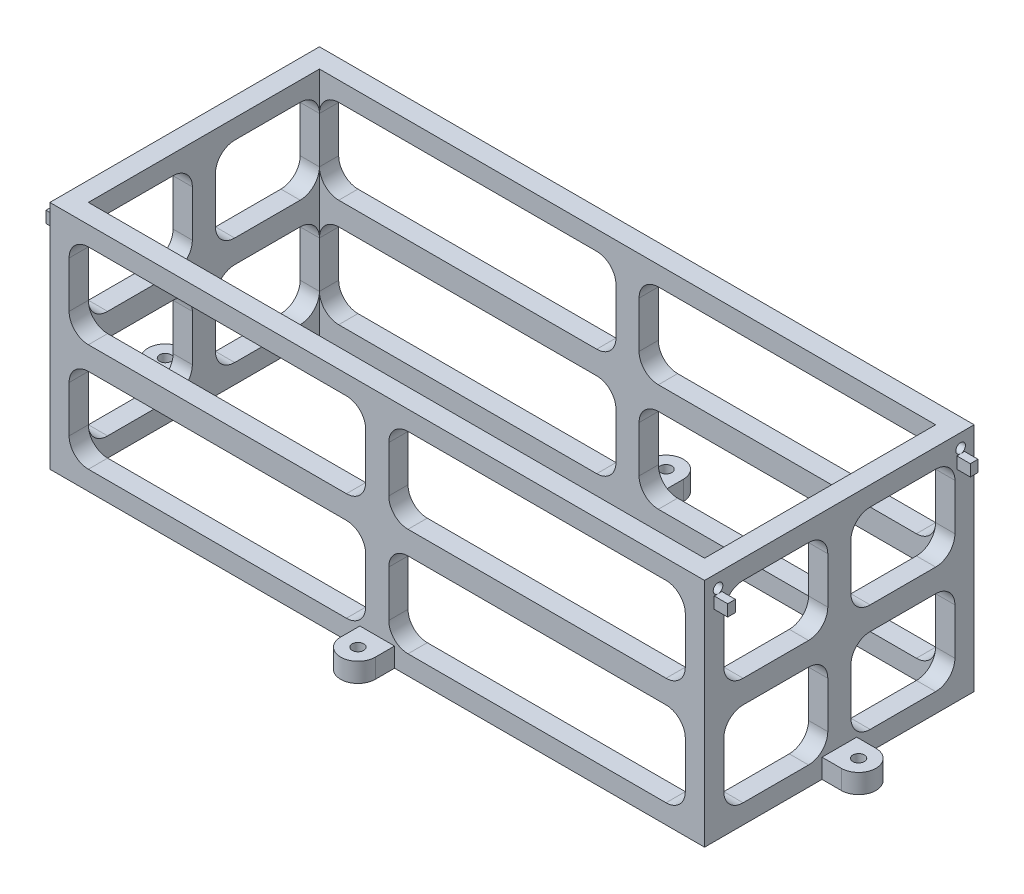
from build123d import *

# Parameters (mm, degrees)
SKETCH1_W           = 170
SKETCH1_H           = 70
BOSS_EXTRUDE1_DEPTH = 60
SHELL1_T            = -5
CUT_EXTRUDE1_DEPTH  = 170
CUT_EXTRUDE2_DEPTH  = 90
SKETCH6_R           = 4.5
SKETCH6_R_2         = 1.5
SKETCH6_W           = 9
SKETCH6_H           = 10
SKETCH6_W_2         = 10
SKETCH6_H_2         = 9
BOSS_EXTRUDE2_DEPTH = 5
SKETCH7_R           = 1.5
CUT_EXTRUDE3_DEPTH  = 5
SKETCH8_R           = 1.25
CUT_EXTRUDE4_DEPTH  = 5
CUT_EXTRUDE5_START  = -5
SKETCH9_R           = 1.25
CUT_EXTRUDE5_DEPTH  = 5
SKETCH10_W          = 2
SKETCH10_H          = 3
BOSS_EXTRUDE3_DEPTH = 3.5
SKETCH11_W          = 2
SKETCH11_H          = 3
BOSS_EXTRUDE4_DEPTH = 3.5


with BuildPart() as part:
    # Sketch1 → Boss-Extrude1 (new body)
    with BuildSketch(Plane(origin=(0, 0, 0), x_dir=(1, 0, 0), z_dir=(0, 1, 0))):
        Rectangle(SKETCH1_W, SKETCH1_H)
    extrude(amount=BOSS_EXTRUDE1_DEPTH)

    # Shell1
    shell1_openings = [part.faces().sort_by_distance(p)[0] for p in [
        (0, 60, 0),
        (0, 0, 0),
    ]]
    offset(amount=SHELL1_T, openings=shell1_openings, kind=Kind.INTERSECTION)

    # Sketch4 → Cut-Extrude1 (cut)
    with BuildSketch(Plane(origin=(85, 0, 0), x_dir=(0, 0, -1), z_dir=(1, 0, 0))):
        with BuildLine():
            Line((-25, 55), (-8, 55))
            ThreePointArc((-8, 55), (-4.464466094, 53.535533906), (-3, 50))
            Line((-3, 50), (-3, 38))
            ThreePointArc((-3, 38), (-4.464466094, 34.464466094), (-8, 33))
            Line((-8, 33), (-25, 33))
            ThreePointArc((-25, 33), (-28.535533906, 34.464466094), (-30, 38))
            Line((-30, 38), (-30, 50))
            ThreePointArc((-30, 50), (-28.535533906, 53.535533906), (-25, 55))
        make_face()
        with BuildLine():
            Line((-25, 27), (-8, 27))
            ThreePointArc((-8, 27), (-4.464466094, 25.535533906), (-3, 22))
            Line((-3, 22), (-3, 10))
            ThreePointArc((-3, 10), (-4.464466094, 6.464466094), (-8, 5))
            Line((-8, 5), (-25, 5))
            ThreePointArc((-25, 5), (-28.535533906, 6.464466094), (-30, 10))
            Line((-30, 10), (-30, 22))
            ThreePointArc((-30, 22), (-28.535533906, 25.535533906), (-25, 27))
        make_face()
        with BuildLine():
            Line((8, 55), (25, 55))
            ThreePointArc((25, 55), (28.535533906, 53.535533906), (30, 50))
            Line((30, 50), (30, 38))
            ThreePointArc((30, 38), (28.535533906, 34.464466094), (25, 33))
            Line((25, 33), (8, 33))
            ThreePointArc((8, 33), (4.464466094, 34.464466094), (3, 38))
            Line((3, 38), (3, 50))
            ThreePointArc((3, 50), (4.464466094, 53.535533906), (8, 55))
        make_face()
        with BuildLine():
            Line((8, 27), (25, 27))
            ThreePointArc((25, 27), (28.535533906, 25.535533906), (30, 22))
            Line((30, 22), (30, 10))
            ThreePointArc((30, 10), (28.535533906, 6.464466094), (25, 5))
            Line((25, 5), (8, 5))
            ThreePointArc((8, 5), (4.464466094, 6.464466094), (3, 10))
            Line((3, 10), (3, 22))
            ThreePointArc((3, 22), (4.464466094, 25.535533906), (8, 27))
        make_face()
    extrude(amount=-CUT_EXTRUDE1_DEPTH, mode=Mode.SUBTRACT)

    # Sketch5 → Cut-Extrude2 (cut)
    with BuildSketch(Plane.XY.offset(35)):
        with BuildLine():
            Line((-75, 55), (-8, 55))
            ThreePointArc((-8, 55), (-4.464466094, 53.535533906), (-3, 50))
            Line((-3, 50), (-3, 38))
            ThreePointArc((-3, 38), (-4.464466094, 34.464466094), (-8, 33))
            Line((-8, 33), (-75, 33))
            ThreePointArc((-75, 33), (-78.535533906, 34.464466094), (-80, 38))
            Line((-80, 38), (-80, 50))
            ThreePointArc((-80, 50), (-78.535533906, 53.535533906), (-75, 55))
        make_face()
        with BuildLine():
            Line((-75, 27), (-8, 27))
            ThreePointArc((-8, 27), (-4.464466094, 25.535533906), (-3, 22))
            Line((-3, 22), (-3, 10))
            ThreePointArc((-3, 10), (-4.464466094, 6.464466094), (-8, 5))
            Line((-8, 5), (-75, 5))
            ThreePointArc((-75, 5), (-78.535533906, 6.464466094), (-80, 10))
            Line((-80, 10), (-80, 22))
            ThreePointArc((-80, 22), (-78.535533906, 25.535533906), (-75, 27))
        make_face()
        with BuildLine():
            Line((8, 55), (75, 55))
            ThreePointArc((75, 55), (78.535533906, 53.535533906), (80, 50))
            Line((80, 50), (80, 38))
            ThreePointArc((80, 38), (78.535533906, 34.464466094), (75, 33))
            Line((75, 33), (8, 33))
            ThreePointArc((8, 33), (4.464466094, 34.464466094), (3, 38))
            Line((3, 38), (3, 50))
            ThreePointArc((3, 50), (4.464466094, 53.535533906), (8, 55))
        make_face()
        with BuildLine():
            Line((8, 27), (75, 27))
            ThreePointArc((75, 27), (78.535533906, 25.535533906), (80, 22))
            Line((80, 22), (80, 10))
            ThreePointArc((80, 10), (78.535533906, 6.464466094), (75, 5))
            Line((75, 5), (8, 5))
            ThreePointArc((8, 5), (4.464466094, 6.464466094), (3, 10))
            Line((3, 10), (3, 22))
            ThreePointArc((3, 22), (4.464466094, 25.535533906), (8, 27))
        make_face()
    extrude(amount=-CUT_EXTRUDE2_DEPTH, mode=Mode.SUBTRACT)

    # Sketch6 → Boss-Extrude2 (add)
    # profile 1 of 8: a face of its own
    with BuildSketch(Plane.XZ):
        with Locations((0, 40)):
            Circle(SKETCH6_R)
    # profile 2 of 8: a face of its own
    with BuildSketch(Plane.XZ):
        with Locations((90, 0)):
            Circle(SKETCH6_R)
    # profile 3 of 8: a face of its own
    with BuildSketch(Plane.XZ):
        with Locations((0, -40)):
            Circle(SKETCH6_R)
    # profile 4 of 8: a face of its own
    with BuildSketch(Plane.XZ):
        with Locations((-90, 0)):
            Circle(SKETCH6_R)
        with Locations((-90, 0)):
            Circle(SKETCH6_R_2, mode=Mode.SUBTRACT)
    # profile 5 of 8: a face of its own
    with BuildSketch(Plane.XZ):
        with Locations((0, 35)):
            Rectangle(SKETCH6_W, SKETCH6_H)
    # profile 6 of 8: a face of its own
    with BuildSketch(Plane.XZ):
        with Locations((-85, 0)):
            Rectangle(SKETCH6_W_2, SKETCH6_H_2)
    # profile 7 of 8: a face of its own
    with BuildSketch(Plane.XZ):
        with Locations((0, -35)):
            Rectangle(SKETCH6_W, SKETCH6_H)
    # profile 8 of 8: a face of its own
    with BuildSketch(Plane.XZ):
        with Locations((85, 0)):
            Rectangle(SKETCH6_W_2, SKETCH6_H_2)
    extrude(amount=-BOSS_EXTRUDE2_DEPTH)

    # Sketch7 → Cut-Extrude3 (cut)
    with BuildSketch(Plane.XZ):
        with Locations((0, 40)):
            Circle(SKETCH7_R)
        with Locations((-90, 0)):
            Circle(SKETCH7_R)
        with Locations((0, -40)):
            Circle(SKETCH7_R)
        with Locations((90, 0)):
            Circle(SKETCH7_R)
    extrude(amount=-CUT_EXTRUDE3_DEPTH, mode=Mode.SUBTRACT)

    # Sketch8 → Cut-Extrude4 (cut)
    with BuildSketch(Plane(origin=(85, 0, 0), x_dir=(0, 0, -1), z_dir=(1, 0, 0))):
        with Locations((-31.5, 56.5)):
            Circle(SKETCH8_R)
        with Locations((31.5, 56.5)):
            Circle(SKETCH8_R)
    extrude(amount=-CUT_EXTRUDE4_DEPTH, mode=Mode.SUBTRACT)

    # Sketch9 → Cut-Extrude5 (cut)
    with BuildSketch(Plane.ZY.offset(85).offset(CUT_EXTRUDE5_START)):
        with Locations((-31.5, 56.5)):
            Circle(SKETCH9_R)
        with Locations((31.5, 56.5)):
            Circle(SKETCH9_R)
    extrude(amount=CUT_EXTRUDE5_DEPTH, mode=Mode.SUBTRACT)

    # Sketch10 → Boss-Extrude3 (add)
    with BuildSketch(Plane.ZY.offset(85)):
        with Locations((-31.5, 53.75)):
            Rectangle(SKETCH10_W, SKETCH10_H)
        with Locations((31.5, 53.75)):
            Rectangle(SKETCH10_W, SKETCH10_H)
    extrude(amount=BOSS_EXTRUDE3_DEPTH)

    # Sketch11 → Boss-Extrude4 (add)
    with BuildSketch(Plane(origin=(85, 0, 0), x_dir=(0, 0, -1), z_dir=(1, 0, 0))):
        with Locations((-31.5, 53.75)):
            Rectangle(SKETCH11_W, SKETCH11_H)
        with Locations((31.5, 53.75)):
            Rectangle(SKETCH11_W, SKETCH11_H)
    extrude(amount=BOSS_EXTRUDE4_DEPTH)


solid = part.part
